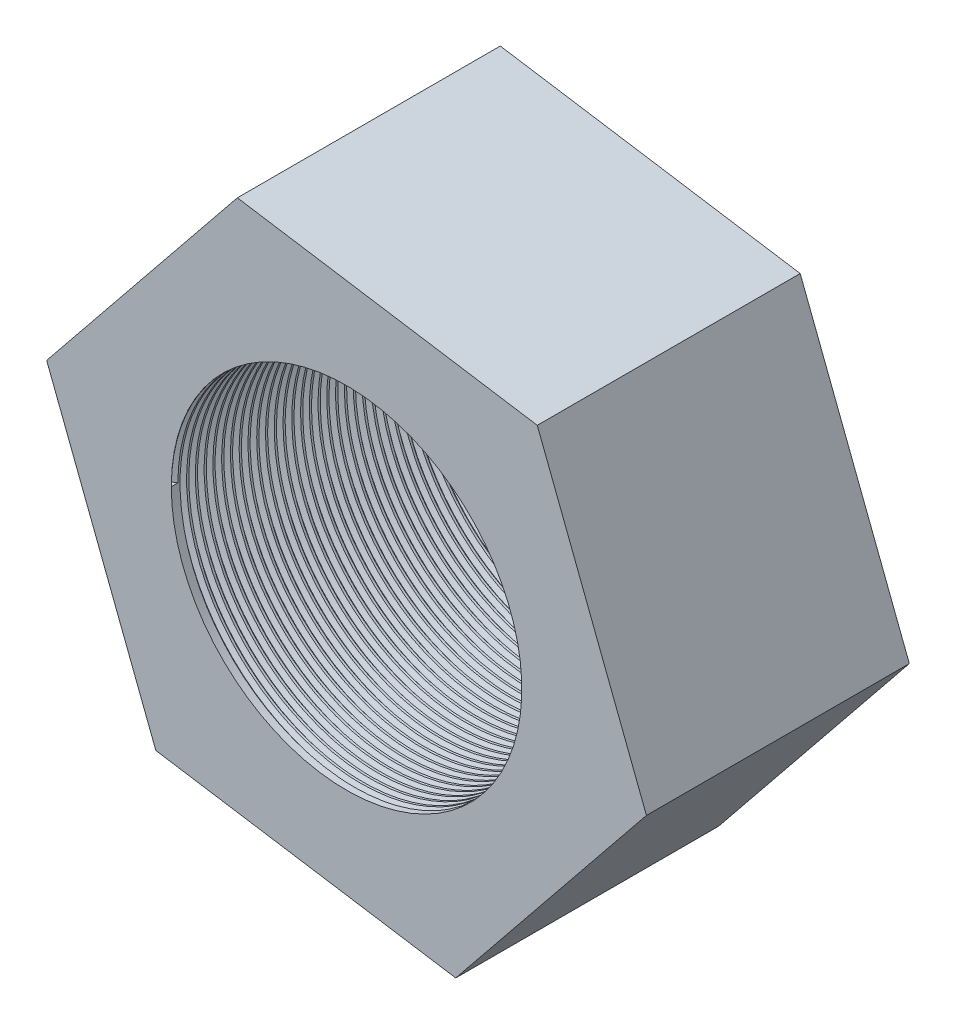
from build123d import *

# Parameters (mm, degrees)
SKETCH1_R           = 6.35
BOSS_EXTRUDE1_DEPTH = 9.525
THREAD1_PITCH       = 0.3175


with BuildPart() as part:
    # Sketch1 → Boss-Extrude1 (new body)
    with BuildSketch(Plane.XY):
        Polygon((10.865385572, -1.706134924), (6.910248973, 8.556632465), (-3.955136599, 10.262767389), (-10.865385572, 1.706134924), (-6.910248973, -8.556632465), (3.955136599, -10.262767389), align=None)
        with Locations(Location((0, 0, 0), (0, 0, 180))):
            Circle(SKETCH1_R, mode=Mode.SUBTRACT)
    extrude(amount=BOSS_EXTRUDE1_DEPTH)

    # Thread1: the profile of Thread Profile1 profile screwed along a right-hand helix of 40 turns, 6 arcs to a turn; built about Z, then put on its axis
    thread1_z = Axis((0, 0, 0), (0, 0, 1))
    thread1_corners = [(6.3497, 0, -0.000173205), (6.521851915, 0, 0.09921875), (6.521851915, 0, 0.13890625), (6.3497, 0, 0.238298204)]
    with BuildLine(mode=Mode.PRIVATE) as thread1_profile:
        Line(thread1_corners[0], thread1_corners[1])
        Line(thread1_corners[1], thread1_corners[2])
        Line(thread1_corners[2], thread1_corners[3])
        Line(thread1_corners[3], thread1_corners[0])
    thread1_cap = Face(thread1_profile.wire())
    thread1_turn_angles = [0, 30, 60, 90, 120, 150, 180, 210, 240, 270, 300, 330, 360, 390, 420, 450, 480, 510, 540, 570, 600, 630, 660, 690, 720]
    thread1_turn_weights = [1, 0.8660254037844387, 1, 0.8660254037844387, 1, 0.8660254037844387, 1, 0.8660254037844387, 1, 0.8660254037844387, 1, 0.8660254037844387, 1, 0.8660254037844387, 1, 0.8660254037844387, 1, 0.8660254037844387, 1, 0.8660254037844387, 1, 0.8660254037844387, 1, 0.8660254037844387, 1]
    thread1_turn_rails = [Edge.make_bspline([Vector(p[0], p[1], 0).rotate(thread1_z, thread1_turn_angles[k]) / thread1_turn_weights[k] + Vector(0, 0, p[2] + THREAD1_PITCH * thread1_turn_angles[k] / 360) for k in range(25)], [0, 0, 0, 1, 1, 2, 2, 3, 3, 4, 4, 5, 5, 6, 6, 7, 7, 8, 8, 9, 9, 10, 10, 11, 11, 12, 12, 12], 2, thread1_turn_weights) for p in thread1_corners]
    thread1_turn_sides = [Face.make_surface_from_curves(thread1_turn_rails[p[0]], thread1_turn_rails[p[1]]) for p in [(0, 1), (1, 2), (2, 3), (3, 0)]]
    thread1 = Plane(origin=(0, 0, 9.525), x_dir=(-1, 0, 0), z_dir=(0, 0, -1)) * Solid(Shell([*[p.moved(Location((0, 0, 2 * THREAD1_PITCH * i))) for i in range(20) for p in thread1_turn_sides], thread1_cap, thread1_cap.rotate(thread1_z, 14400).moved(Location((0, 0, THREAD1_PITCH * 14400 / 360)))]))
    add(thread1, mode=Mode.SUBTRACT)


solid = part.part
